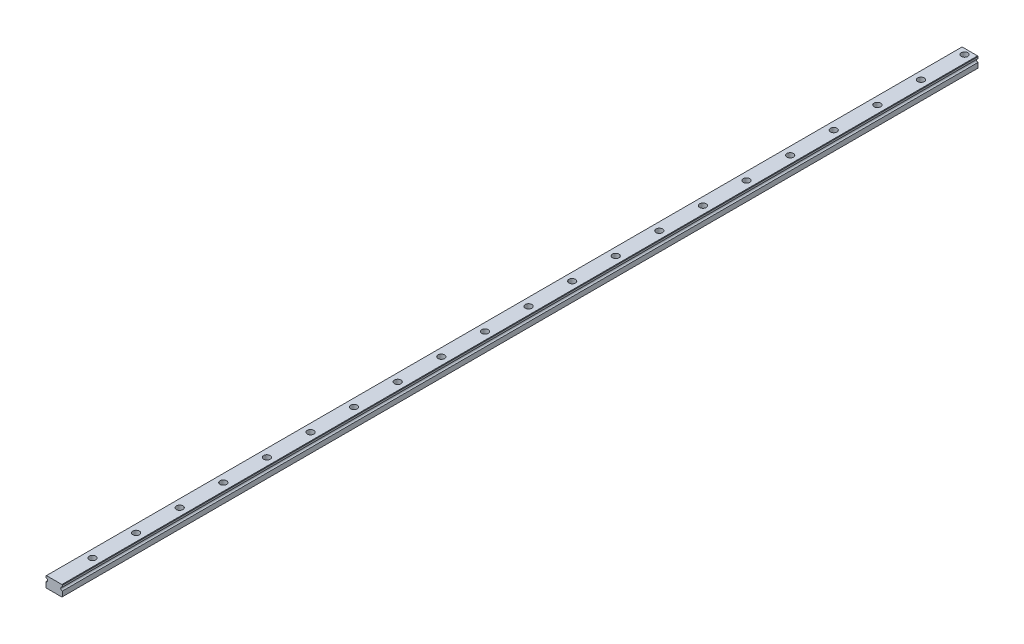
from build123d import *

# Parameters (mm, degrees)
EXTRUDE_1_DEPTH        = 1000
SKETCH_2_R             = 1.5
CUT_EXTRUDE_1_DEPTH    = 20
SKETCH_3_R             = 3
CUT_EXTRUDE_2_DEPTH    = 4.5
PATTERN_LINEAR_1_COUNT = 25
PATTERN_LINEAR_1_PITCH = 40
CUT_EXTRUDE_4_DEPTH    = 80
CUT_EXTRUDE_5_DEPTH    = 80


with BuildPart() as part:
    # 草图1 → 凸台-拉伸1 (new body)
    with BuildSketch(Plane.XY):
        with BuildLine():
            Line((-7.643186957, 0.234233912), (-7.643186957, -4.365766088))
            Line((-7.643186957, -4.365766088), (-7.243186957, -4.765766088))
            Line((-7.243186957, -4.765766088), (6.956813043, -4.765766088))
            Line((6.956813043, -4.765766088), (7.356813043, -4.365766088))
            Line((7.356813043, -4.365766088), (7.356813043, 0.234233912))
            ThreePointArc((7.356813043, 0.234233912), (6.296152871, 0.67357374), (5.856813043, 1.734233912))
            ThreePointArc((5.856813043, 1.734233912), (6.296152871, 2.794894084), (7.356813043, 3.234233912))
            Line((7.356813043, 3.234233912), (7.356813043, 4.834233912))
            Line((7.356813043, 4.834233912), (6.956813043, 5.234233912))
            Line((6.956813043, 5.234233912), (-7.243186957, 5.234233912))
            Line((-7.243186957, 5.234233912), (-7.643186957, 4.834233912))
            Line((-7.643186957, 4.834233912), (-7.643186957, 3.234233912))
            ThreePointArc((-7.643186957, 3.234233912), (-6.143186957, 1.734233912), (-7.643186957, 0.234233912))
        make_face()
    extrude(amount=EXTRUDE_1_DEPTH)

    # 草图2 → 切除-拉伸1 (cut)
    with BuildSketch(Plane(origin=(0, 5.234233912, 0), x_dir=(1, 0, 0), z_dir=(0, 1, 0))):
        with Locations((0, -4.968968642)):
            Circle(SKETCH_2_R)
    cut_extrude_1 = extrude(amount=-CUT_EXTRUDE_1_DEPTH, mode=Mode.SUBTRACT)

    # 草图3 → 切除-拉伸2 (cut)
    with BuildSketch(Plane(origin=(0, 5.234233912, 0), x_dir=(1, 0, 0), z_dir=(0, 1, 0))):
        with Locations((0, -4.968968642)):
            Circle(SKETCH_3_R)
    cut_extrude_2 = extrude(amount=-CUT_EXTRUDE_2_DEPTH, mode=Mode.SUBTRACT)

    # 阵列(线性)1: 切除-拉伸1, 切除-拉伸2 ×25
    with Locations(*[(0, 0, i * PATTERN_LINEAR_1_PITCH) for i in range(1, PATTERN_LINEAR_1_COUNT)]):
        add(cut_extrude_1, mode=Mode.SUBTRACT)
        add(cut_extrude_2, mode=Mode.SUBTRACT)

    # 草图6 → 切除-拉伸4 (cut)
    with BuildSketch(Plane(origin=(0, 0, 0), x_dir=(-1, 0, 0), z_dir=(0, 0, -1))):
        with BuildLine():
            Line((7.643186957, 3.234233912), (7.643186957, 4.834233912))
            Line((7.643186957, 4.834233912), (7.243186957, 5.234233912))
            Line((7.243186957, 5.234233912), (-6.956813043, 5.234233912))
            Line((-6.956813043, 5.234233912), (-7.356813043, 4.834233912))
            Line((-7.356813043, 4.834233912), (-7.356813043, 3.234233912))
            ThreePointArc((-7.356813043, 3.234233912), (-5.856813043, 1.734233912), (-7.356813043, 0.234233912))
            Line((-7.356813043, 0.234233912), (-7.356813043, -4.365766088))
            Line((-7.356813043, -4.365766088), (-6.956813043, -4.765766088))
            Line((-6.956813043, -4.765766088), (7.243186957, -4.765766088))
            Line((7.243186957, -4.765766088), (7.643186957, -4.365766088))
            Line((7.643186957, -4.365766088), (7.643186957, 0.234233912))
            ThreePointArc((7.643186957, 0.234233912), (6.143186957, 1.734233912), (7.643186957, 3.234233912))
        make_face()
    extrude(amount=-CUT_EXTRUDE_4_DEPTH, mode=Mode.SUBTRACT)

    # 草图7 → 切除-拉伸5 (cut)
    with BuildSketch(Plane(origin=(0, 0, 80), x_dir=(-1, 0, 0), z_dir=(0, 0, -1))):
        with BuildLine():
            Line((7.643186957, 3.234233912), (7.643186957, 4.834233912))
            Line((7.643186957, 4.834233912), (7.243186957, 5.234233912))
            Line((7.243186957, 5.234233912), (-6.956813043, 5.234233912))
            Line((-6.956813043, 5.234233912), (-7.356813043, 4.834233912))
            Line((-7.356813043, 4.834233912), (-7.356813043, 3.234233912))
            ThreePointArc((-7.356813043, 3.234233912), (-5.856813043, 1.734233912), (-7.356813043, 0.234233912))
            Line((-7.356813043, 0.234233912), (-7.356813043, -4.365766088))
            Line((-7.356813043, -4.365766088), (-6.956813043, -4.765766088))
            Line((-6.956813043, -4.765766088), (7.243186957, -4.765766088))
            Line((7.243186957, -4.765766088), (7.643186957, -4.365766088))
            Line((7.643186957, -4.365766088), (7.643186957, 0.234233912))
            ThreePointArc((7.643186957, 0.234233912), (6.143186957, 1.734233912), (7.643186957, 3.234233912))
        make_face()
    extrude(amount=-CUT_EXTRUDE_5_DEPTH, mode=Mode.SUBTRACT)


solid = part.part
